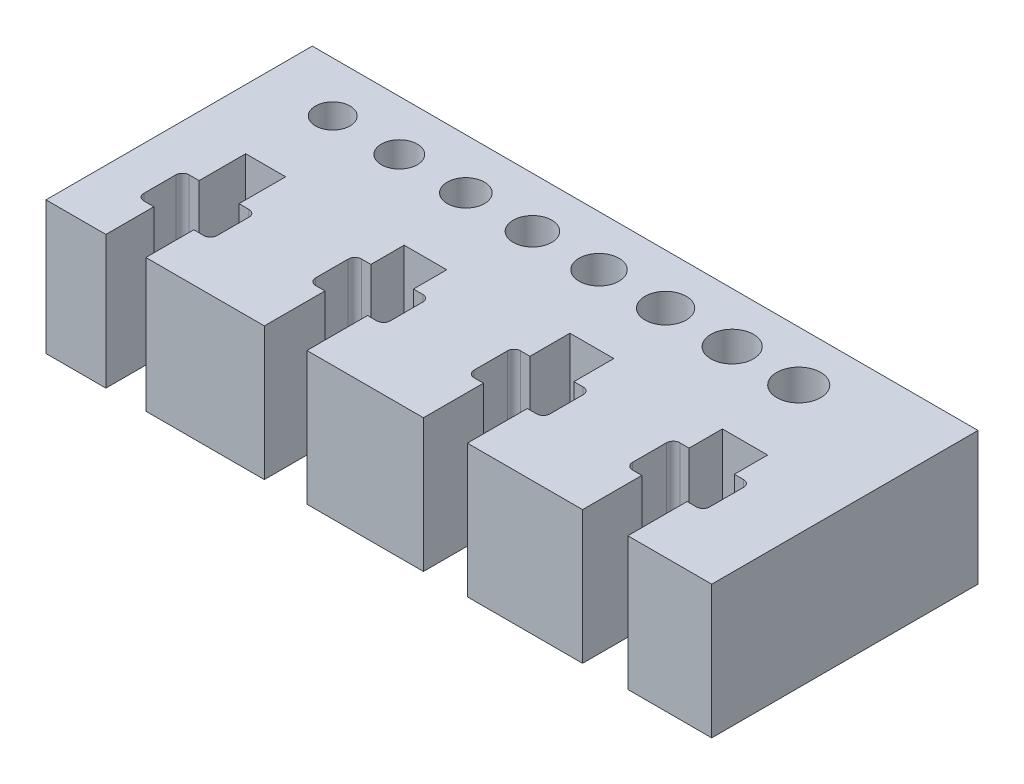
from build123d import *

# Parameters (mm, degrees)
SKETCH2_W           = 50
SKETCH2_H           = 20
BOSS_EXTRUDE1_DEPTH = 10
SKETCH3_R           = 1.3
SKETCH3_R_2         = 1.35
SKETCH3_R_3         = 1.4
SKETCH3_R_4         = 1.45
SKETCH3_R_5         = 1.5
SKETCH3_R_6         = 1.55
SKETCH3_R_7         = 1.6
SKETCH3_R_8         = 1.65
CUT_EXTRUDE1_DEPTH  = 29.722813233


with BuildPart() as part:
    # Sketch2 → Boss-Extrude1 (new body)
    with BuildSketch(Plane(origin=(0, 0, 0), x_dir=(1, 0, 0), z_dir=(0, 1, 0))):
        Rectangle(SKETCH2_W, SKETCH2_H)
    extrude(amount=BOSS_EXTRUDE1_DEPTH)

    # Sketch3 → Cut-Extrude1 (cut, through all)
    with BuildSketch(Plane(origin=(0, 10, 0), x_dir=(1, 0, 0), z_dir=(0, 1, 0))):
        with Locations((-19.685722489, 6.222302146)):
            Circle(SKETCH3_R)
        with Locations((-14.685722489, 6.222302146)):
            Circle(SKETCH3_R_2)
        with Locations((-9.685722489, 6.222302146)):
            Circle(SKETCH3_R_3)
        with Locations((-4.685722489, 6.222302146)):
            Circle(SKETCH3_R_4)
        with Locations((0.314277511, 6.222302146)):
            Circle(SKETCH3_R_5)
        with Locations((5.314277511, 6.222302146)):
            Circle(SKETCH3_R_6)
        with Locations((10.314277511, 6.222302146)):
            Circle(SKETCH3_R_7)
        with Locations((15.314277511, 6.222302146)):
            Circle(SKETCH3_R_8)
        with BuildLine():
            Line((6.65, -10), (3.35, -10))
            Line((3.35, -10), (3.35, -5.5))
            Line((3.35, -5.5), (2.65, -5.5))
            ThreePointArc((2.65, -5.5), (2.296446609, -5.353553391), (2.15, -5))
            Line((2.15, -5), (2.15, -2.5))
            ThreePointArc((2.15, -2.5), (2.296446609, -2.146446609), (2.65, -2))
            Line((2.65, -2), (3.35, -2))
            Line((3.35, -2), (3.35, 1))
            Line((3.35, 1), (6.65, 1))
            Line((6.65, 1), (6.65, -2))
            Line((6.65, -2), (7.35, -2))
            ThreePointArc((7.35, -2), (7.703553391, -2.146446609), (7.85, -2.5))
            Line((7.85, -2.5), (7.85, -5))
            ThreePointArc((7.85, -5), (7.703553391, -5.353553391), (7.35, -5.5))
            Line((7.35, -5.5), (6.65, -5.5))
            Line((6.65, -5.5), (6.65, -10))
        make_face()
        with BuildLine():
            Line((15.3, 0.5), (18.7, 0.5))
            Line((18.7, 0.5), (18.7, -2))
            Line((18.7, -2), (19.4, -2))
            ThreePointArc((19.4, -2), (19.753553391, -2.146446609), (19.9, -2.5))
            Line((19.9, -2.5), (19.9, -5.05))
            ThreePointArc((19.9, -5.05), (19.753553391, -5.403553391), (19.4, -5.55))
            Line((19.4, -5.55), (18.7, -5.55))
            Line((18.7, -5.55), (18.7, -10))
            Line((18.7, -10), (15.3, -10))
            Line((15.3, -10), (15.3, -5.55))
            Line((15.3, -5.55), (14.6, -5.55))
            ThreePointArc((14.6, -5.55), (14.246446609, -5.403553391), (14.1, -5.05))
            Line((14.1, -5.05), (14.1, -2.5))
            ThreePointArc((14.1, -2.5), (14.246446609, -2.146446609), (14.6, -2))
            Line((14.6, -2), (15.3, -2))
            Line((15.3, -2), (15.3, 0.5))
        make_face()
        with BuildLine():
            Line((-8.6, 0.5), (-5.4, 0.5))
            Line((-5.4, 0.5), (-5.4, -2))
            Line((-5.4, -2), (-4.7, -2))
            ThreePointArc((-4.7, -2), (-4.346446609, -2.146446609), (-4.2, -2.5))
            Line((-4.2, -2.5), (-4.2, -4.95))
            ThreePointArc((-4.2, -4.95), (-4.346446609, -5.303553391), (-4.7, -5.45))
            Line((-4.7, -5.45), (-5.4, -5.45))
            Line((-5.4, -5.45), (-5.4, -10))
            Line((-5.4, -10), (-8.6, -10))
            Line((-8.6, -10), (-8.6, -5.45))
            Line((-8.6, -5.45), (-9.3, -5.45))
            ThreePointArc((-9.3, -5.45), (-9.653553391, -5.303553391), (-9.8, -4.95))
            Line((-9.8, -4.95), (-9.8, -2.5))
            ThreePointArc((-9.8, -2.5), (-9.653553391, -2.146446609), (-9.3, -2))
            Line((-9.3, -2), (-8.6, -2))
            Line((-8.6, -2), (-8.6, 0.5))
        make_face()
        with BuildLine():
            Line((-20.5, 0.5), (-17.5, 0.5))
            Line((-17.5, 0.5), (-17.5, -3))
            Line((-17.5, -3), (-16.75, -3))
            ThreePointArc((-16.75, -3), (-16.396446609, -3.146446609), (-16.25, -3.5))
            Line((-16.25, -3.5), (-16.25, -5.9))
            ThreePointArc((-16.25, -5.9), (-16.396446609, -6.253553391), (-16.75, -6.4))
            Line((-16.75, -6.4), (-17.5, -6.4))
            Line((-17.5, -6.4), (-17.5, -10))
            Line((-17.5, -10), (-20.5, -10))
            Line((-20.5, -10), (-20.5, -6.4))
            Line((-20.5, -6.4), (-21.25, -6.4))
            ThreePointArc((-21.25, -6.4), (-21.603553391, -6.253553391), (-21.75, -5.9))
            Line((-21.75, -5.9), (-21.75, -3.5))
            ThreePointArc((-21.75, -3.5), (-21.603553391, -3.146446609), (-21.25, -3))
            Line((-21.25, -3), (-20.5, -3))
            Line((-20.5, -3), (-20.5, 0.5))
        make_face()
    extrude(amount=-CUT_EXTRUDE1_DEPTH, mode=Mode.SUBTRACT)


solid = part.part
